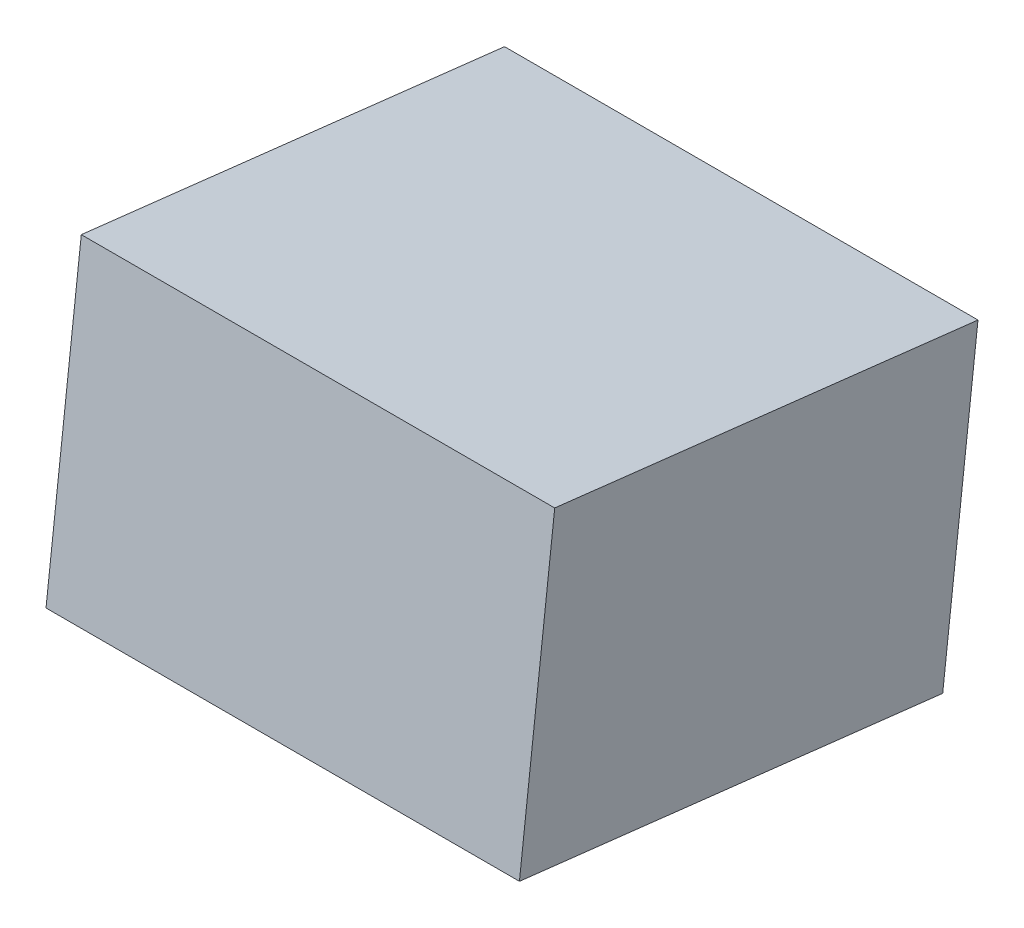
from build123d import *

# Parameters (mm, degrees)
SKETCH1_W           = 200
SKETCH1_H           = 180
BOSS_EXTRUDE1_DEPTH = 130


with BuildPart() as part:
    # Sketch1 → Boss-Extrude1 (new body)
    with BuildSketch(Plane(origin=(0, 343.978805368, -39.702551724), x_dir=(1, 0, 0), z_dir=(-6.8385480190203005e-15, 0.9934047622419532, -0.11466027365660884))):
        with Locations((-124.731736994, 150.244347434)):
            Rectangle(SKETCH1_W, SKETCH1_H)
    extrude(amount=BOSS_EXTRUDE1_DEPTH)


solid = part.part
